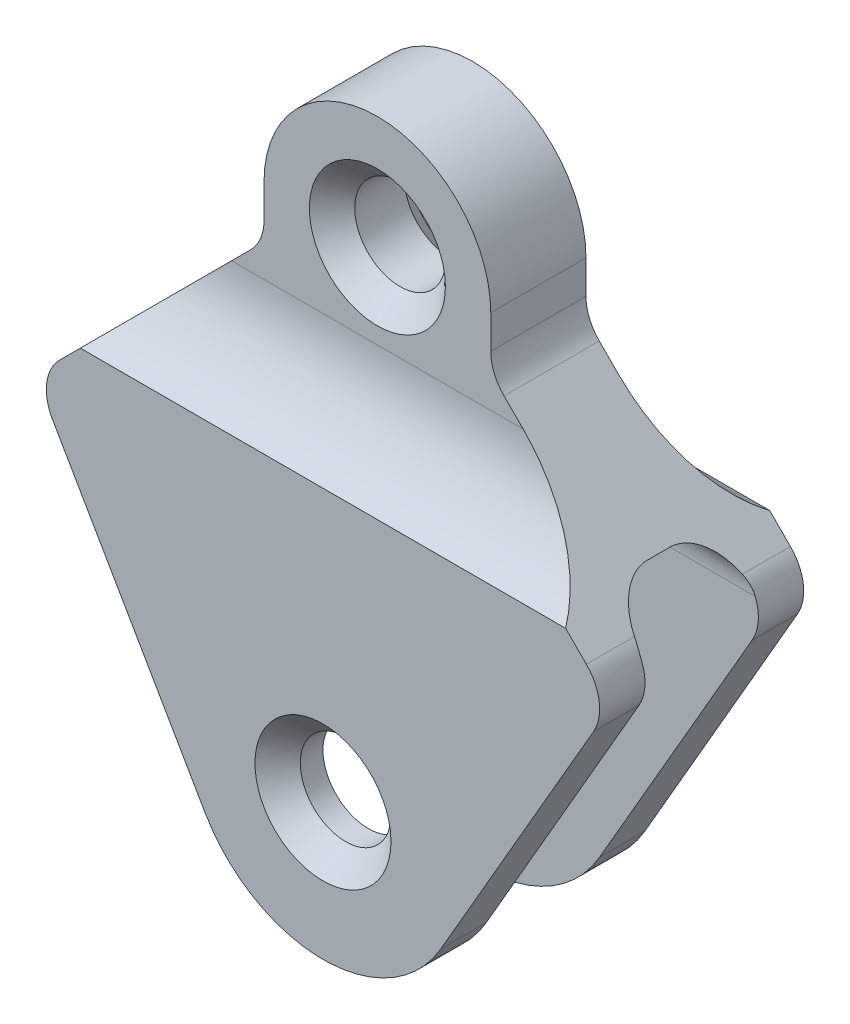
from build123d import *

# Parameters (mm, degrees)
SKETCH1_R                      = 10
BOSS_EXTRUDE1_DEPTH            = 45
CUT_EXTRUDE1_REACH             = 153.52
SKETCH2_W                      = 25
SKETCH2_H                      = 92
CUT_EXTRUDE1_DIRECTION_2_REACH = 153.52
FILLET2_R                      = 10
FILLET3_R                      = 10
CUT_EXTRUDE5_REACH             = 164.244
SKETCH4_W                      = 12
SKETCH4_H                      = 65
CUT_EXTRUDE5_DIRECTION_2_REACH = 164.244
FILLET4_R                      = 25
CHAMFER1_SIZE                  = 5


with BuildPart() as part:
    # Sketch1 → Boss-Extrude1 (new body)
    with BuildSketch(Plane.XY):
        with BuildLine():
            Line((-25, 0), (-25, -11.491470389))
            Line((-25, -11.491470389), (-63.508529611, -50))
            Line((-63.508529611, -50), (-25.980762114, -115))
            ThreePointArc((-25.980762114, -115), (0, -130), (25.980762114, -115))
            Line((25.980762114, -115), (63.508529611, -50))
            Line((63.508529611, -50), (25, -11.491470389))
            Line((25, -11.491470389), (25, 0))
            ThreePointArc((25, 0), (0, 25), (-25, 0))
        make_face()
        Circle(SKETCH1_R, mode=Mode.SUBTRACT)
        with Locations((0, -100)):
            Circle(SKETCH1_R, mode=Mode.SUBTRACT)
    extrude(amount=-BOSS_EXTRUDE1_DEPTH)

    # Sketch2 → Cut-Extrude1 (cut, up to next)
    with BuildSketch(Plane(origin=(0, 0, 0), x_dir=(0, 0, -1), z_dir=(1, 0, 0)), mode=Mode.PRIVATE) as cut_extrude1_sk1:
        with Locations((22.5, -84)):
            Rectangle(SKETCH2_W, SKETCH2_H)
    cut_extrude1_tool1 = extrude(cut_extrude1_sk1.sketch, amount=-CUT_EXTRUDE1_REACH, mode=Mode.PRIVATE) & part.part
    add(cut_extrude1_tool1.solids().sort_by_distance((0, -84, -22.5))[0], mode=Mode.SUBTRACT)

    # Sketch2 → Cut-Extrude1 direction 2 (cut, up to next)
    with BuildSketch(Plane(origin=(0, 0, 0), x_dir=(0, 0, -1), z_dir=(1, 0, 0)), mode=Mode.PRIVATE) as cut_extrude1_direction_2_sk1:
        with Locations((22.5, -84)):
            Rectangle(SKETCH2_W, SKETCH2_H)
    cut_extrude1_direction_2_tool1 = extrude(cut_extrude1_direction_2_sk1.sketch, amount=CUT_EXTRUDE1_DIRECTION_2_REACH, mode=Mode.PRIVATE) & part.part
    add(cut_extrude1_direction_2_tool1.solids().sort_by_distance((0, -84, -22.5))[0], mode=Mode.SUBTRACT)

    # Fillet2
    fillet2_edges = [part.edges().sort_by_distance(p)[0] for p in [
        (25, -11.491470389, -22.5),
        (63.508529611, -50, -40),
        (-63.508529611, -50, -40),
        (-25, -11.491470389, -22.5),
        (-63.508529611, -50, -5),
        (63.508529611, -50, -5),
    ]]
    fillet(fillet2_edges, radius=FILLET2_R)

    # Fillet3
    fillet3_edges = [part.edges().sort_by_distance(p)[0] for p in [
        (0, -38, -10),
        (0, -38, -35),
    ]]
    fillet(fillet3_edges, radius=FILLET3_R)

    # Sketch4 → Cut-Extrude5 (cut, up to next)
    with BuildSketch(Plane(origin=(25, 0, 0), x_dir=(0, 0, -1), z_dir=(1, 0, 0)), mode=Mode.PRIVATE) as cut_extrude5_sk1:
        with Locations((39, -7.5)):
            Rectangle(SKETCH4_W, SKETCH4_H)
    cut_extrude5_tool1 = extrude(cut_extrude5_sk1.sketch, amount=-CUT_EXTRUDE5_REACH, mode=Mode.PRIVATE) & part.part
    # Sketch4 → Cut-Extrude5 (cut, up to next)
    with BuildSketch(Plane(origin=(25, 0, 0), x_dir=(0, 0, -1), z_dir=(1, 0, 0)), mode=Mode.PRIVATE) as cut_extrude5_sk2:
        with Locations((6, -7.5)):
            Rectangle(SKETCH4_W, SKETCH4_H)
    cut_extrude5_tool2 = extrude(cut_extrude5_sk2.sketch, amount=-CUT_EXTRUDE5_REACH, mode=Mode.PRIVATE) & part.part
    add(cut_extrude5_tool1.solids().sort_by_distance((25, -7.5, -39))[0], mode=Mode.SUBTRACT)
    add(cut_extrude5_tool2.solids().sort_by_distance((25, -7.5, -6))[0], mode=Mode.SUBTRACT)

    # Sketch4 → Cut-Extrude5 direction 2 (cut, up to next)
    with BuildSketch(Plane(origin=(25, 0, 0), x_dir=(0, 0, -1), z_dir=(1, 0, 0)), mode=Mode.PRIVATE) as cut_extrude5_direction_2_sk1:
        with Locations((39, -7.5)):
            Rectangle(SKETCH4_W, SKETCH4_H)
    cut_extrude5_direction_2_tool1 = extrude(cut_extrude5_direction_2_sk1.sketch, amount=CUT_EXTRUDE5_DIRECTION_2_REACH, mode=Mode.PRIVATE) & part.part
    # Sketch4 → Cut-Extrude5 direction 2 (cut, up to next)
    with BuildSketch(Plane(origin=(25, 0, 0), x_dir=(0, 0, -1), z_dir=(1, 0, 0)), mode=Mode.PRIVATE) as cut_extrude5_direction_2_sk2:
        with Locations((6, -7.5)):
            Rectangle(SKETCH4_W, SKETCH4_H)
    cut_extrude5_direction_2_tool2 = extrude(cut_extrude5_direction_2_sk2.sketch, amount=CUT_EXTRUDE5_DIRECTION_2_REACH, mode=Mode.PRIVATE) & part.part
    add(cut_extrude5_direction_2_tool1.solids().sort_by_distance((25, -7.5, -39))[0], mode=Mode.SUBTRACT)
    add(cut_extrude5_direction_2_tool2.solids().sort_by_distance((25, -7.5, -6))[0], mode=Mode.SUBTRACT)

    # Fillet4
    # the kernel refuses this fillet: 25 mm, written as the material it adds along each edge
    with BuildSketch(Plane(origin=(-106.893920871, -40, -33), x_dir=(0, 1, 0), z_dir=(1, 0, 0))) as fillet4_piece_1_section:
        with BuildLine():
            CenterArc((21.354156504, -25), FILLET4_R, 90, 58.667748502)
            Line((0, -12), (-0.42708313, -11.74))
            ThreePointArc((-0.42708313, -11.74), (-0.5, -6), (-0.5, 0))
            Line((-0.5, 0), (0, 0.5))
            Line((0, 0.5), (21.354156504, 0.5))
            Line((21.354156504, 0.5), (21.354156504, 0))
        make_face()
    fillet4_piece_1 = extrude(amount=213.787841742, mode=Mode.PRIVATE)
    fillet4_piece_1 = split(fillet4_piece_1, bisect_by=Plane(origin=(-24.314247143, -10.805717532, -36.275046533), z_dir=(0.7071067811865465, -0.7071067811865487, 0)), keep=Keep.TOP, mode=Mode.PRIVATE)
    fillet4_piece_1 = split(fillet4_piece_1, bisect_by=Plane(origin=(24.314247143, -10.805717532, -36.275046533), z_dir=(-0.7071067811865465, -0.7071067811865487, 0)), keep=Keep.TOP, mode=Mode.PRIVATE)
    add(fillet4_piece_1)
    with BuildSketch(Plane(origin=(-106.893920871, -40, -12), x_dir=(0, 0, 1), z_dir=(1, 0, 0))) as fillet4_piece_2_section:
        with BuildLine():
            CenterArc((25, -21.354156504), FILLET4_R, 121.332251498, 58.667748502)
            Line((0, -21.354156504), (-0.5, -21.354156504))
            Line((-0.5, -21.354156504), (-0.5, 0))
            Line((-0.5, 0), (0, 0.5))
            ThreePointArc((0, 0.5), (6, 0.5), (11.74, 0.42708313))
            Line((11.74, 0.42708313), (12, 0))
        make_face()
    fillet4_piece_2 = extrude(amount=213.787841742, mode=Mode.PRIVATE)
    fillet4_piece_2 = split(fillet4_piece_2, bisect_by=Plane(origin=(-24.314247143, -10.805717532, -8.724953467), z_dir=(0.7071067811865465, -0.7071067811865487, 0)), keep=Keep.TOP, mode=Mode.PRIVATE)
    fillet4_piece_2 = split(fillet4_piece_2, bisect_by=Plane(origin=(24.314247143, -10.805717532, -8.724953467), z_dir=(-0.7071067811865465, -0.7071067811865487, 0)), keep=Keep.TOP, mode=Mode.PRIVATE)
    add(fillet4_piece_2)

    # Chamfer1
    chamfer1_edges = [part.edges().sort_by_distance(p)[0] for p in [
        (-10, 0, -12),
        (-10, 0, -33),
        (-10, -100, -45),
        (-10, -100, 0),
    ]]
    chamfer(chamfer1_edges, length=CHAMFER1_SIZE)


solid = part.part
